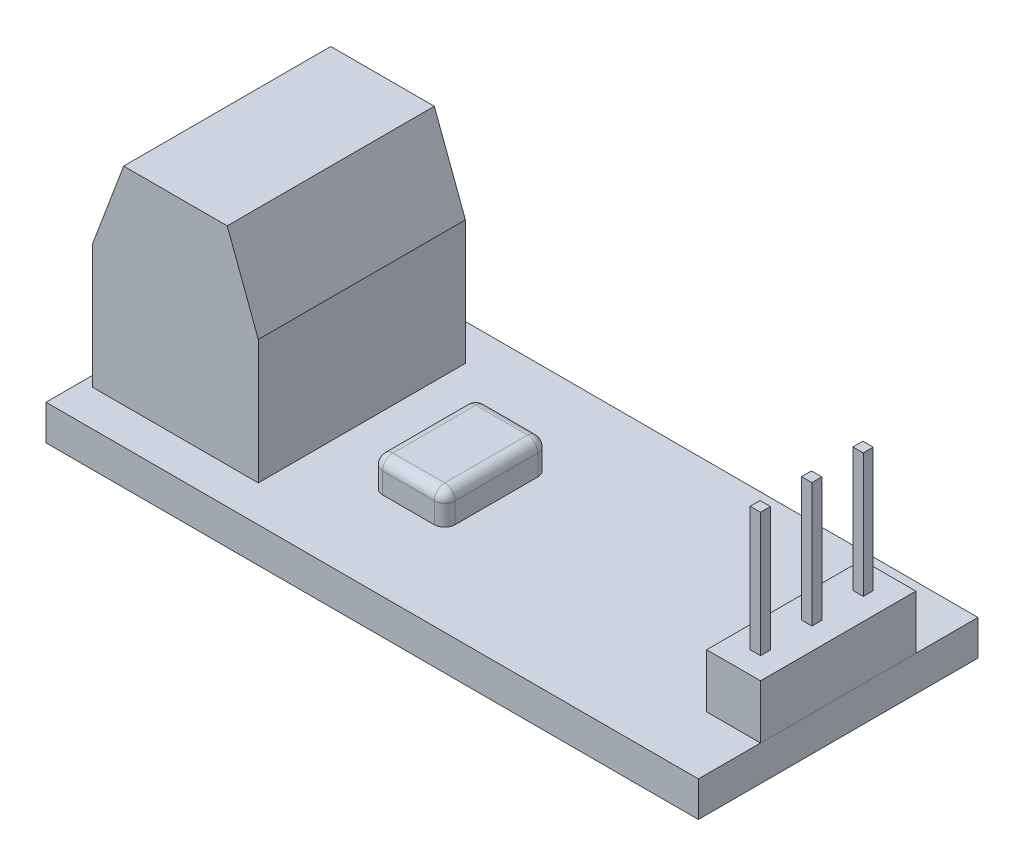
from build123d import *

# Parameters (mm, degrees)
CROQUIS1_W                = 31.5
CROQUIS1_H                = 13.5
SALIENTE_EXTRUIR1_DEPTH   = 1.7
CROQUIS2_W                = 2.6
CROQUIS2_H                = 7.5
SALIENTE_EXTRUIR2_DEPTH   = 2.6
CROQUIS3_W                = 0.5
CROQUIS3_H                = 0.480769231
SALIENTE_EXTRUIR3_DEPTH   = 6
CROQUIS3_H_2              = 0.48076923
SALIENTE_EXTRUIR3_2_DEPTH = 6
SALIENTE_EXTRUIR3_3_DEPTH = 6
CROQUIS4_W                = 8
CROQUIS4_H                = 10
SALIENTE_EXTRUIR4_DEPTH   = 10
CORTAR_EXTRUIR1_DEPTH     = 23.869521202
CROQUIS6_W                = 3.5
CROQUIS6_H                = 5
SALIENTE_EXTRUIR5_DEPTH   = 1.5
REDONDEO1_R               = 0.5


with BuildPart() as part:
    # Croquis1 → Saliente-Extruir1 (new body)
    with BuildSketch(Plane(origin=(0, 0, 0), x_dir=(1, 0, 0), z_dir=(0, 1, 0))):
        Rectangle(CROQUIS1_W, CROQUIS1_H)
    extrude(amount=SALIENTE_EXTRUIR1_DEPTH)


with BuildPart() as body_2:
    # Croquis2 → Saliente-Extruir2 (new body)
    with BuildSketch(Plane(origin=(0, 1.7, 0), x_dir=(1, 0, 0), z_dir=(0, 1, 0))):
        with Locations((14.45, 0)):
            Rectangle(CROQUIS2_W, CROQUIS2_H)
    extrude(amount=SALIENTE_EXTRUIR2_DEPTH)


with BuildPart() as body_3:
    # Croquis3 → Saliente-Extruir3 (new body)
    with BuildSketch(Plane(origin=(0, 4.3, 0), x_dir=(1, 0, 0), z_dir=(0, 1, 0))):
        with Locations((14.45, 0.01923077)):
            Rectangle(CROQUIS3_W, CROQUIS3_H)
    extrude(amount=SALIENTE_EXTRUIR3_DEPTH)


with BuildPart() as body_4:
    # Croquis3 → Saliente-Extruir3 2 (new body)
    with BuildSketch(Plane(origin=(0, 4.3, 0), x_dir=(1, 0, 0), z_dir=(0, 1, 0))):
        with Locations((14.45, 2.5)):
            Rectangle(CROQUIS3_W, CROQUIS3_H_2)
    extrude(amount=SALIENTE_EXTRUIR3_2_DEPTH)


with BuildPart() as body_5:
    # Croquis3 → Saliente-Extruir3 3 (new body)
    with BuildSketch(Plane(origin=(0, 4.3, 0), x_dir=(1, 0, 0), z_dir=(0, 1, 0))):
        with Locations((14.45, -2.461538461)):
            Rectangle(CROQUIS3_W, CROQUIS3_H)
    extrude(amount=SALIENTE_EXTRUIR3_3_DEPTH)


with BuildPart() as body_6:
    # Croquis4 → Saliente-Extruir4 (new body)
    with BuildSketch(Plane(origin=(0, 1.7, 0), x_dir=(1, 0, 0), z_dir=(0, 1, 0))):
        with Locations((-11.25, 0)):
            Rectangle(CROQUIS4_W, CROQUIS4_H)
    extrude(amount=SALIENTE_EXTRUIR4_DEPTH)

    # Croquis5 → Cortar-Extruir1 (cut, through all)
    with BuildSketch(Plane.XY.offset(5)):
        Polygon((-8.75, 11.7), (-7.25, 7.7), (-7.25, 11.7), align=None)
        Polygon((-15.25, 7.7), (-15.25, 11.7), (-13.75, 11.7), align=None)
    extrude(amount=-CORTAR_EXTRUIR1_DEPTH, mode=Mode.SUBTRACT)


with BuildPart() as body_7:
    # Croquis6 → Saliente-Extruir5 (new body)
    with BuildSketch(Plane(origin=(0, 1.7, 0), x_dir=(1, 0, 0), z_dir=(0, 1, 0))):
        with Locations((-2.5, 0)):
            Rectangle(CROQUIS6_W, CROQUIS6_H)
    extrude(amount=SALIENTE_EXTRUIR5_DEPTH)

    # Redondeo1
    redondeo1_edges = [body_7.edges().sort_by_distance(p)[0] for p in [
        (-4.25, 2.45, -2.5),
        (-0.75, 2.45, -2.5),
        (-4.25, 2.45, 2.5),
        (-0.75, 2.45, 2.5),
        (-2.5, 3.2, -2.5),
        (-4.25, 3.2, 0),
        (-2.5, 3.2, 2.5),
        (-0.75, 3.2, 0),
    ]]
    fillet(redondeo1_edges, radius=REDONDEO1_R)


solid = Compound([part.part, body_2.part, body_3.part, body_4.part, body_5.part, body_6.part, body_7.part])
